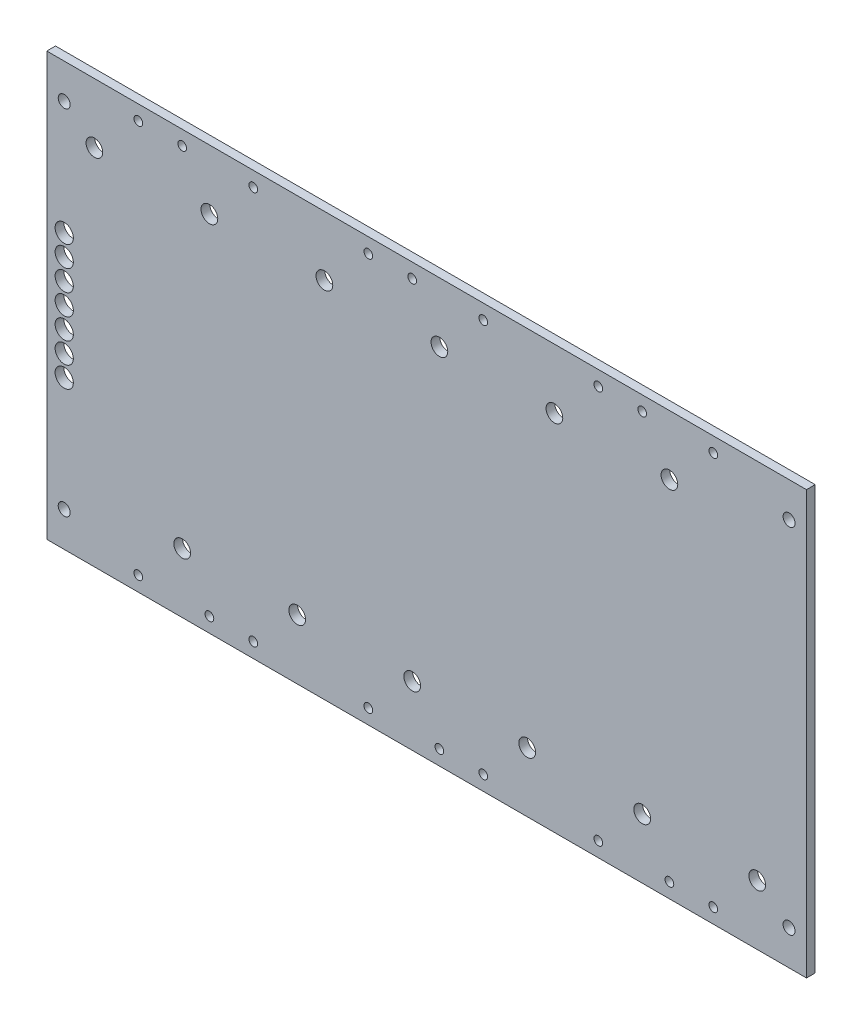
from build123d import *

# Parameters (mm, degrees)
SKETCH1_R           = 0.79375
SKETCH1_R_2         = 1.0922
SKETCH1_R_3         = 1.524
SKETCH1_R_4         = 1.659299133
BOSS_EXTRUDE1_DEPTH = 1.5875


with BuildPart() as part:
    # Sketch1 → Boss-Extrude1 (new body)
    with BuildSketch(Plane.XY):
        Polygon((-6.35, 0), (0, 0), (132.08, 0), (132.08, 77.0636), (0, 77.0636), (-6.35, 77.0636), align=None)
        with Locations((10.3251, 2.6924)):
            Circle(SKETCH1_R, mode=Mode.SUBTRACT)
        with Locations((-3.175, 6.35)):
            Circle(SKETCH1_R_2, mode=Mode.SUBTRACT)
        with Locations((23.2791, 2.6924)):
            Circle(SKETCH1_R, mode=Mode.SUBTRACT)
        with Locations((18.3261, 10.9093)):
            Circle(SKETCH1_R_3, mode=Mode.SUBTRACT)
        with Locations((31.2801, 2.6924)):
            Circle(SKETCH1_R, mode=Mode.SUBTRACT)
        with Locations((52.2351, 2.6924)):
            Circle(SKETCH1_R, mode=Mode.SUBTRACT)
        with Locations((39.2811, 10.9093)):
            Circle(SKETCH1_R_3, mode=Mode.SUBTRACT)
        with Locations((60.2361, 10.9093)):
            Circle(SKETCH1_R_3, mode=Mode.SUBTRACT)
        with Locations((-3.175, 27.1018)):
            Circle(SKETCH1_R_4, mode=Mode.SUBTRACT)
        with Locations((-3.175, 30.9118)):
            Circle(SKETCH1_R_4, mode=Mode.SUBTRACT)
        with Locations((-3.175, 34.7218)):
            Circle(SKETCH1_R_4, mode=Mode.SUBTRACT)
        with Locations((65.1891, 2.6924)):
            Circle(SKETCH1_R, mode=Mode.SUBTRACT)
        with Locations((73.1901, 2.6924)):
            Circle(SKETCH1_R, mode=Mode.SUBTRACT)
        with Locations((94.1451, 2.6924)):
            Circle(SKETCH1_R, mode=Mode.SUBTRACT)
        with Locations((81.1911, 10.9093)):
            Circle(SKETCH1_R_3, mode=Mode.SUBTRACT)
        with Locations((107.0991, 2.6924)):
            Circle(SKETCH1_R, mode=Mode.SUBTRACT)
        with Locations((115.1001, 2.6924)):
            Circle(SKETCH1_R, mode=Mode.SUBTRACT)
        with Locations((128.905, 6.35)):
            Circle(SKETCH1_R_2, mode=Mode.SUBTRACT)
        with Locations((102.1461, 10.9093)):
            Circle(SKETCH1_R_3, mode=Mode.SUBTRACT)
        with Locations((123.1011, 10.9093)):
            Circle(SKETCH1_R_3, mode=Mode.SUBTRACT)
        with Locations((-3.175, 38.5318)):
            Circle(SKETCH1_R_4, mode=Mode.SUBTRACT)
        with Locations((-3.175, 42.3418)):
            Circle(SKETCH1_R_4, mode=Mode.SUBTRACT)
        with Locations((-3.175, 46.1518)):
            Circle(SKETCH1_R_4, mode=Mode.SUBTRACT)
        with Locations((-3.175, 49.9618)):
            Circle(SKETCH1_R_4, mode=Mode.SUBTRACT)
        with Locations((2.3241, 66.1543)):
            Circle(SKETCH1_R_3, mode=Mode.SUBTRACT)
        with Locations((23.2791, 66.1543)):
            Circle(SKETCH1_R_3, mode=Mode.SUBTRACT)
        with Locations((-3.175, 70.7136)):
            Circle(SKETCH1_R_2, mode=Mode.SUBTRACT)
        with Locations((10.3251, 74.3712)):
            Circle(SKETCH1_R, mode=Mode.SUBTRACT)
        with Locations((18.3261, 74.4347)):
            Circle(SKETCH1_R, mode=Mode.SUBTRACT)
        with Locations((44.2341, 66.1543)):
            Circle(SKETCH1_R_3, mode=Mode.SUBTRACT)
        with Locations((31.2801, 74.3712)):
            Circle(SKETCH1_R, mode=Mode.SUBTRACT)
        with Locations((52.2351, 74.3712)):
            Circle(SKETCH1_R, mode=Mode.SUBTRACT)
        with Locations((60.2361, 74.4347)):
            Circle(SKETCH1_R, mode=Mode.SUBTRACT)
        with Locations((65.1891, 66.1543)):
            Circle(SKETCH1_R_3, mode=Mode.SUBTRACT)
        with Locations((86.1441, 66.1543)):
            Circle(SKETCH1_R_3, mode=Mode.SUBTRACT)
        with Locations((73.1901, 74.3712)):
            Circle(SKETCH1_R, mode=Mode.SUBTRACT)
        with Locations((94.1451, 74.3712)):
            Circle(SKETCH1_R, mode=Mode.SUBTRACT)
        with Locations((107.0991, 66.1543)):
            Circle(SKETCH1_R_3, mode=Mode.SUBTRACT)
        with Locations((102.1461, 74.4347)):
            Circle(SKETCH1_R, mode=Mode.SUBTRACT)
        with Locations((128.905, 70.7136)):
            Circle(SKETCH1_R_2, mode=Mode.SUBTRACT)
        with Locations((115.1001, 74.3712)):
            Circle(SKETCH1_R, mode=Mode.SUBTRACT)
    extrude(amount=BOSS_EXTRUDE1_DEPTH)


solid = part.part
